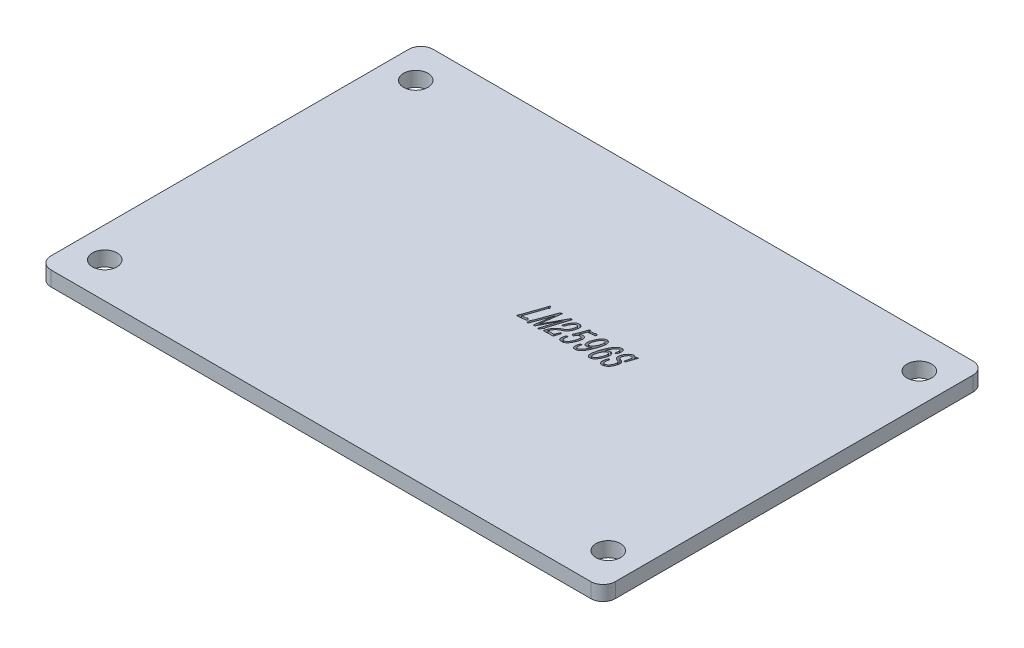
from build123d import *

# Parameters (mm, degrees)
SKETCH_1_R          = 1.65
EXTRUDE_1_DEPTH     = 2
CUT_EXTRUDE_START   = -1
CUT_EXTRUDE_1_DEPTH = 1


# Read off the part's stored shape, not the designer's step: 切除-拉伸1
with BuildPart() as part:
    # 草图1 → 凸台-拉伸1 (new body)
    with BuildSketch(Plane(origin=(0, 0, 0), x_dir=(1, 0, 0), z_dir=(0, 1, 0))):
        with BuildLine():
            Line((36.45, -25.8), (-36.45, -25.8))
            ThreePointArc((-36.45, -25.8), (-37.616726189, -25.316726189), (-38.1, -24.15))
            Line((-38.1, -24.15), (-38.1, 24.15))
            ThreePointArc((-38.1, 24.15), (-37.616726189, 25.316726189), (-36.45, 25.8))
            Line((-36.45, 25.8), (36.45, 25.8))
            ThreePointArc((36.45, 25.8), (37.616726189, 25.316726189), (38.1, 24.15))
            Line((38.1, 24.15), (38.1, -24.15))
            ThreePointArc((38.1, -24.15), (37.616726189, -25.316726189), (36.45, -25.8))
        make_face()
        with Locations(Location((-34, 21, 0), (0, 0, 270))):
            Circle(SKETCH_1_R, mode=Mode.SUBTRACT)
        with Locations(Location((34, 21, 0), (0, 0, 90))):
            Circle(SKETCH_1_R, mode=Mode.SUBTRACT)
        with Locations(Location((34, -21, 0), (0, 0, 270))):
            Circle(SKETCH_1_R, mode=Mode.SUBTRACT)
        with Locations(Location((-34, -21, 0), (0, 0, 90))):
            Circle(SKETCH_1_R, mode=Mode.SUBTRACT)
    extrude(amount=EXTRUDE_1_DEPTH)

    # 切除-拉伸1 outline → 切除-拉伸1 (cut)
    # profile 1 of 7: a face of its own
    with BuildSketch(Plane(origin=(0, 2, 0), x_dir=(1, 0, 0), z_dir=(0, 1, 0)).offset(CUT_EXTRUDE_START)):
        with BuildLine():
            add(Edge.make_bspline(
                [(11.319624973, 2.529725123), (11.326753338, 2.567830624), (11.339981513, 2.638543373), (11.363810052, 2.738810386), (11.386747264, 2.83309971), (11.402493277, 2.928406503), (11.408788686, 3.024022456), (11.40107061, 3.101456515), (11.384715065, 3.156938358), (11.369804851, 3.194089384), (11.348293758, 3.225207318), (11.322963493, 3.250684221), (11.294296694, 3.270288272), (11.263524636, 3.284015152), (11.230211949, 3.291074833), (11.184684427, 3.290006717), (11.129135658, 3.280496298), (11.076013715, 3.25837237), (11.034406929, 3.229718869), (10.996101664, 3.199008787), (10.95262477, 3.156252878), (10.901523079, 3.105345591), (10.847119389, 3.043543935), (10.792558439, 2.971198575), (10.736915044, 2.889534868), (10.664019856, 2.766635878), (10.576158329, 2.602847504), (10.499771775, 2.433051534), (10.445727973, 2.301323215), (10.421585689, 2.239116022), (10.410345271, 2.210525074)],
                knots=[0, 0, 0, 0, 0.048016888, 0.089105405, 0.127654772, 0.168210064, 0.208611881, 0.246125029, 0.263765638, 0.280183723, 0.295474126, 0.310282398, 0.324462469, 0.338252576, 0.351782306, 0.366256964, 0.394408992, 0.421179489, 0.436725185, 0.456877911, 0.481929832, 0.512200465, 0.546242109, 0.583815889, 0.624389886, 0.668597469, 0.76077153, 0.854490538, 0.899099648, 0.93715592, 0.93715592, 0.93715592, 0.93715592], degree=3))
            Line((11.319624973, 2.529725123), (11.486682293, 2.553590454))
            Line((11.486682293, 2.553590454), (11.542616663, 2.577455785))
            Line((11.542616663, 2.577455785), (11.59705945, 2.735563605))
            add(Edge.make_bspline(
                [(11.300980183, 3.558171745), (11.332938296, 3.55537961), (11.391604224, 3.55025405), (11.470752634, 3.530082967), (11.533066183, 3.499358127), (11.576123996, 3.457009642), (11.604543879, 3.412414193), (11.628279189, 3.371220088), (11.645918441, 3.332653625), (11.656575541, 3.294841352), (11.663922251, 3.255421395), (11.665904063, 3.210409655), (11.667264725, 3.158391127), (11.663279952, 3.101732242), (11.660194196, 3.045264039), (11.655589125, 2.993299452), (11.650667761, 2.948240187), (11.642153035, 2.894323663), (11.626748851, 2.823432882), (11.607663016, 2.766946106), (11.59705945, 2.735563605)],
                knots=[0, 0, 0, 0, 0.091586168, 0.168125935, 0.232336966, 0.287622003, 0.338278218, 0.383145194, 0.423552602, 0.459085297, 0.495189033, 0.537922916, 0.587673765, 0.643887342, 0.700141333, 0.749361491, 0.792995872, 0.829682411, 0.905376226, 1, 1, 1, 1], degree=3))
            add(Edge.make_bspline(
                [(10.078627743, 2.088962284), (10.092043775, 2.124514194), (10.117212009, 2.191208933), (10.152737815, 2.284990134), (10.185663794, 2.365405537), (10.225197569, 2.458460171), (10.279164702, 2.571015442), (10.346529938, 2.7098071), (10.422825779, 2.84851108), (10.4891655, 2.962189864), (10.547655064, 3.05014134), (10.597371436, 3.11763489), (10.654008389, 3.186987801), (10.714203242, 3.258491084), (10.779252353, 3.326433394), (10.846166624, 3.388282473), (10.915212273, 3.440367594), (10.984767437, 3.48551032), (11.058000786, 3.520567517), (11.135394035, 3.544224908), (11.216917438, 3.558489113), (11.272581603, 3.55827896), (11.300980183, 3.558171745)],
                knots=[0, 0, 0, 0, 0.056410835, 0.105825706, 0.14886341, 0.185400755, 0.255897094, 0.334127727, 0.414387224, 0.490842857, 0.529430594, 0.571134342, 0.615225599, 0.662339254, 0.709844425, 0.754777107, 0.797439761, 0.838085033, 0.877703722, 0.91750761, 0.957914275, 1, 1, 1, 1], degree=3))
            add(Edge.make_bspline(
                [(10.220328148, 0.281909227), (10.19249915, 0.280098745), (10.138454152, 0.276582721), (10.070837234, 0.287224422), (10.020300058, 0.307853057), (9.981584961, 0.329435729), (9.942445068, 0.358703245), (9.902806204, 0.393420868), (9.86591267, 0.435175841), (9.837901593, 0.485120934), (9.814521026, 0.539843172), (9.797351744, 0.623039326), (9.785413991, 0.73268396), (9.780797995, 0.847487699), (9.785600824, 0.948152915), (9.796865384, 1.037662616), (9.813201733, 1.140700776), (9.835695491, 1.251967632), (9.860700878, 1.361489032), (9.881452444, 1.45999998), (9.901360112, 1.541057249), (9.921795449, 1.627581379), (9.950036536, 1.724331764), (9.987162506, 1.839703457), (10.030604097, 1.961317245), (10.06209135, 2.045009175), (10.078627743, 2.088962284)],
                knots=[0, 0, 0, 0, 0.03956068, 0.07682838, 0.095843058, 0.116866224, 0.139607214, 0.165118082, 0.191658894, 0.218244295, 0.246111869, 0.275832629, 0.33841793, 0.402715898, 0.438774703, 0.481433334, 0.530775575, 0.586935239, 0.642621152, 0.690341085, 0.729908068, 0.761166336, 0.816603174, 0.872993246, 0.933298924, 1, 1, 1, 1], degree=3))
            add(Edge.make_bspline(
                [(11.068293203, 1.084380993), (11.053872372, 1.05541355), (11.023329038, 0.994060479), (10.969919402, 0.900045656), (10.909148123, 0.797266792), (10.842698841, 0.689580228), (10.77067729, 0.585020153), (10.689912589, 0.496193855), (10.604071033, 0.425272911), (10.514549478, 0.373835141), (10.428409541, 0.337241697), (10.350739054, 0.30914977), (10.282885658, 0.289066112), (10.239814747, 0.284138589), (10.220328148, 0.281909227)],
                knots=[0, 0, 0, 0, 0.079263847, 0.167880907, 0.264814542, 0.371790082, 0.477921398, 0.575347443, 0.664953156, 0.749565857, 0.827301008, 0.893958514, 0.952023584, 1, 1, 1, 1], degree=3))
            add(Edge.make_bspline(
                [(10.866929469, 2.42158534), (10.886589109, 2.42118425), (10.924292828, 2.420415029), (10.978317607, 2.413823439), (11.027127036, 2.402341257), (11.0704245, 2.384465457), (11.110126107, 2.363025804), (11.145250427, 2.334657677), (11.177822239, 2.301762803), (11.206196623, 2.262416031), (11.230840866, 2.217275717), (11.251560663, 2.166182107), (11.268932178, 2.109090825), (11.285125994, 2.024054569), (11.296537056, 1.911174741), (11.289262569, 1.794565371), (11.274634537, 1.697461188), (11.256960519, 1.617881049), (11.23389369, 1.53225165), (11.19483815, 1.411518301), (11.141690833, 1.260480826), (11.092451101, 1.142342016), (11.068293203, 1.084380993)],
                knots=[0, 0, 0, 0, 0.036382012, 0.069774277, 0.100580197, 0.128866596, 0.156266865, 0.183794371, 0.212106964, 0.241746136, 0.273258923, 0.307101626, 0.343643368, 0.383535045, 0.467197852, 0.552918689, 0.598998486, 0.648914818, 0.703726948, 0.763108811, 0.883776925, 1, 1, 1, 1], degree=3))
            add(Edge.make_bspline(
                [(10.410345271, 2.210525074), (10.416050186, 2.215819905), (10.449129723, 2.245792172), (10.515387249, 2.296635031), (10.596944633, 2.34739101), (10.669961017, 2.38141985), (10.730958103, 2.401452348), (10.797361446, 2.414729849), (10.843260597, 2.419252922), (10.866929469, 2.42158534)],
                knots=[0.404971471, 0.404971471, 0.404971471, 0.404971471, 0.432023627, 0.560128766, 0.694717093, 0.765101066, 0.83971451, 0.917345382, 1, 1, 1, 1], degree=3))
        make_face()
        with BuildLine():
            add(Edge.make_bspline(
                [(10.78340081, 2.144150863), (10.773100017, 2.142556458), (10.750618648, 2.139076688), (10.716027357, 2.124014401), (10.676728769, 2.104229335), (10.61950773, 2.068122267), (10.549209543, 2.014286204), (10.485947564, 1.949276583), (10.438225331, 1.889966685), (10.402168059, 1.836055129), (10.362124324, 1.775401551), (10.32250004, 1.70543497), (10.282350459, 1.628120598), (10.242879966, 1.544201096), (10.20537119, 1.453333549), (10.182767084, 1.390009052), (10.171105902, 1.35734072)],
                knots=[0, 0, 0, 0, 0.030109941, 0.065714622, 0.108588335, 0.157792871, 0.261597461, 0.364557771, 0.419941904, 0.482122806, 0.552499195, 0.630638236, 0.715103682, 0.805067532, 0.89943673, 1, 1, 1, 1], degree=3))
            add(Edge.make_bspline(
                [(10.994459834, 1.706371191), (10.996023434, 1.727987763), (10.999094338, 1.770442601), (10.998155227, 1.83301138), (10.993304701, 1.893197713), (10.982810117, 1.949506966), (10.969352689, 2.000724278), (10.95159455, 2.044118522), (10.930889814, 2.079967855), (10.905013561, 2.106412307), (10.876785311, 2.125274258), (10.847149319, 2.138714329), (10.815442897, 2.144403173), (10.79410278, 2.144235134), (10.78340081, 2.144150863)],
                knots=[0, 0, 0, 0, 0.117814531, 0.231387145, 0.339957123, 0.445764662, 0.542521874, 0.627383564, 0.700188791, 0.766158301, 0.826528991, 0.884046869, 0.941850039, 1, 1, 1, 1], degree=3))
            add(Edge.make_bspline(
                [(10.261346687, 0.559343703), (10.277116988, 0.561036132), (10.310050452, 0.564570469), (10.359697313, 0.581371719), (10.411370211, 0.606364875), (10.464387545, 0.639656708), (10.516258175, 0.68049559), (10.566448783, 0.725344467), (10.611522599, 0.776372283), (10.667831669, 0.851112799), (10.731329902, 0.95619793), (10.795934626, 1.094643622), (10.855107472, 1.241413379), (10.915663077, 1.390752272), (10.967307612, 1.545247184), (10.985397457, 1.652594138), (10.994459834, 1.706371191)],
                knots=[0, 0, 0, 0, 0.033065291, 0.069050969, 0.108790502, 0.152905102, 0.19956824, 0.246646067, 0.293375687, 0.341592316, 0.442107469, 0.549241177, 0.660589479, 0.772799957, 0.88618076, 1, 1, 1, 1], degree=3))
            add(Edge.make_bspline(
                [(10.171105902, 1.35734072), (10.157214891, 1.313537581), (10.128946777, 1.22439849), (10.099911739, 1.087160277), (10.082936778, 0.949425392), (10.081717538, 0.837543122), (10.089357472, 0.754881106), (10.09924336, 0.701098577), (10.115046922, 0.655622102), (10.133766577, 0.617106754), (10.158955138, 0.587815623), (10.18889873, 0.567377888), (10.224199621, 0.557126412), (10.248618264, 0.55858395), (10.261346687, 0.559343703)],
                knots=[0, 0, 0, 0, 0.152325287, 0.309980926, 0.464393534, 0.611968529, 0.679892627, 0.739554139, 0.792740957, 0.839202455, 0.880695047, 0.919337794, 0.957954149, 1, 1, 1, 1], degree=3))
        make_face(mode=Mode.SUBTRACT)
    # profile 2 of 7: a face of its own
    with BuildSketch(Plane(origin=(0, 2, 0), x_dir=(1, 0, 0), z_dir=(0, 1, 0)).offset(CUT_EXTRUDE_START)):
        with BuildLine():
            add(Edge.make_bspline(
                [(12.912635841, 3.567867036), (12.939142799, 3.565233706), (12.990134196, 3.560167972), (13.061479373, 3.539212889), (13.125736341, 3.511504093), (13.179321881, 3.472634465), (13.224573033, 3.431830655), (13.258620007, 3.394250591), (13.275885689, 3.369629077), (13.28190395, 3.359344784)],
                knots=[0, 0, 0, 0, 0.160913397, 0.309548871, 0.448301289, 0.582320695, 0.708056454, 0.8167907, 0.888918404, 0.888918404, 0.888918404, 0.888918404], degree=3))
            add(Edge.make_bspline(
                [(12.028872789, 2.730343064), (12.037961875, 2.756585471), (12.05554781, 2.807360352), (12.086989767, 2.878979592), (12.11750693, 2.945449357), (12.162163511, 3.025869263), (12.224268655, 3.12064819), (12.306016893, 3.227829835), (12.393614077, 3.323941803), (12.484290088, 3.405999762), (12.578963013, 3.471260438), (12.661240331, 3.516590821), (12.73159073, 3.543940104), (12.788797484, 3.557595487), (12.849411885, 3.567266944), (12.891215329, 3.567663723), (12.912635841, 3.567867036)],
                knots=[0, 0, 0, 0, 0.064498195, 0.12479374, 0.181637338, 0.234373753, 0.338350867, 0.444636662, 0.547250782, 0.640116115, 0.728083073, 0.81387459, 0.857749845, 0.902998931, 0.950295664, 1, 1, 1, 1], degree=3))
            add(Edge.make_bspline(
                [(12.213829107, 1.920413382), (12.18380199, 1.935425676), (12.124665966, 1.964991197), (12.061289845, 2.0182297), (12.019942917, 2.06725959), (11.994543204, 2.10732764), (11.973202676, 2.150129614), (11.957629324, 2.196825794), (11.947181788, 2.247139404), (11.942356007, 2.301149805), (11.941503127, 2.358766382), (11.94621769, 2.42089776), (11.956966845, 2.488708612), (11.974384709, 2.5631426), (11.998467725, 2.64475035), (12.018397516, 2.700854323), (12.028872789, 2.730343064)],
                knots=[0, 0, 0, 0, 0.107404064, 0.211523776, 0.262460483, 0.312661898, 0.363291962, 0.415479857, 0.470049255, 0.527721881, 0.589115285, 0.654664533, 0.727279933, 0.809086455, 0.899654161, 1, 1, 1, 1], degree=3))
            Line((12.213829107, 1.920413382), (12.398039633, 1.841359472))
            add(Edge.make_bspline(
                [(12.585233326, 1.240251438), (12.594400313, 1.274448647), (12.611296104, 1.33747796), (12.62795106, 1.425432934), (12.636008327, 1.498379763), (12.633269717, 1.558239262), (12.622779176, 1.608147262), (12.608581966, 1.652170455), (12.587575031, 1.690922305), (12.562719839, 1.726194961), (12.531116406, 1.757888149), (12.493380693, 1.787946863), (12.448445071, 1.816124798), (12.415345898, 1.832695368), (12.398039633, 1.841359472)],
                knots=[0, 0, 0, 0, 0.149796169, 0.276091238, 0.378589772, 0.459715849, 0.528429664, 0.593977199, 0.65469369, 0.714259707, 0.776015707, 0.843387247, 0.918113307, 1, 1, 1, 1], degree=3))
            add(Edge.make_bspline(
                [(11.931174089, 0.574259535), (11.95160895, 0.574956763), (11.991801323, 0.576328107), (12.050331783, 0.58771282), (12.10533799, 0.6066983), (12.15778136, 0.632425154), (12.207284117, 0.665796263), (12.256453349, 0.704089904), (12.304001843, 0.748899201), (12.363583365, 0.815241572), (12.430281098, 0.898970165), (12.494124356, 1.005113843), (12.545134858, 1.117985543), (12.571358469, 1.197945037), (12.585233326, 1.240251438)],
                knots=[0, 0, 0, 0, 0.06157663, 0.121112194, 0.178948509, 0.236604839, 0.296685232, 0.358612133, 0.424367126, 0.493341319, 0.627383728, 0.746417103, 0.865829817, 1, 1, 1, 1], degree=3))
            add(Edge.make_bspline(
                [(11.776795227, 1.46398892), (11.768461383, 1.425980908), (11.752797092, 1.354541058), (11.732683638, 1.253544708), (11.716322288, 1.165770154), (11.699399386, 1.069455772), (11.687113395, 0.964430817), (11.688733634, 0.867064956), (11.697142974, 0.79769926), (11.708995673, 0.75251395), (11.722406268, 0.711364334), (11.740619482, 0.675611471), (11.760390674, 0.644836582), (11.782109829, 0.620379129), (11.803881566, 0.600607911), (11.835200511, 0.58383917), (11.878312409, 0.573425255), (11.913231895, 0.573976366), (11.931174089, 0.574259535)],
                knots=[0, 0, 0, 0, 0.112864024, 0.212139198, 0.298694179, 0.371837857, 0.495825715, 0.604731979, 0.653479027, 0.698076056, 0.740035884, 0.7787337, 0.814133331, 0.845812142, 0.873421557, 0.898915982, 0.948061405, 1, 1, 1, 1], degree=3))
            Line((11.776795227, 1.46398892), (11.570956744, 1.46398892))
            Line((11.570956744, 1.46398892), (11.482207543, 1.151502237))
            add(Edge.make_bspline(
                [(11.846153846, 0.291604517), (11.821507506, 0.291672515), (11.774402182, 0.291802474), (11.707229629, 0.302668781), (11.647908365, 0.323792617), (11.596166803, 0.353871173), (11.552693807, 0.393226045), (11.514008461, 0.437883281), (11.483088935, 0.490364957), (11.45641734, 0.548064989), (11.437405549, 0.612114312), (11.425614494, 0.681715451), (11.420595756, 0.756164709), (11.423124823, 0.861840183), (11.43937617, 0.995682807), (11.468003001, 1.099826479), (11.482207543, 1.151502237)],
                knots=[0, 0, 0, 0, 0.066209553, 0.126543031, 0.181941951, 0.234679622, 0.286308345, 0.338948483, 0.392946326, 0.449486953, 0.509545765, 0.57196873, 0.638979959, 0.709851081, 0.856029028, 1, 1, 1, 1], degree=3))
            add(Edge.make_bspline(
                [(12.716492649, 0.886746218), (12.690673631, 0.843535161), (12.639155802, 0.757314228), (12.560012956, 0.660765442), (12.494157344, 0.590048647), (12.446439371, 0.542235389), (12.400473609, 0.499550612), (12.354670103, 0.462173232), (12.307160045, 0.427820804), (12.25390394, 0.397983566), (12.195658355, 0.36856258), (12.132248815, 0.342013207), (12.064574224, 0.319473968), (11.993939972, 0.303210907), (11.920780395, 0.293064213), (11.871295667, 0.292096292), (11.846153846, 0.291604517)],
                knots=[0, 0, 0, 0, 0.136340092, 0.272045418, 0.337393071, 0.398407192, 0.455181305, 0.507402547, 0.558653188, 0.613922574, 0.672710074, 0.735558621, 0.800150866, 0.865886795, 0.931860792, 1, 1, 1, 1], degree=3))
            add(Edge.make_bspline(
                [(12.603878116, 2.121777115), (12.625624731, 2.110055924), (12.666928449, 2.087793665), (12.723661478, 2.052989545), (12.771789988, 2.018606704), (12.823834543, 1.974915948), (12.876279106, 1.915606015), (12.913094756, 1.847682595), (12.93267358, 1.790038621), (12.943825739, 1.74470064), (12.947642368, 1.696750531), (12.947439011, 1.629122814), (12.93803875, 1.540489915), (12.922539072, 1.449199842), (12.903377024, 1.372394865), (12.887292499, 1.308688575), (12.865934129, 1.241147333), (12.835749131, 1.144635294), (12.79080682, 1.023351055), (12.741226002, 0.932211244), (12.716492649, 0.886746218)],
                knots=[0, 0, 0, 0, 0.051978856, 0.098724335, 0.139954766, 0.176325786, 0.241579757, 0.305248117, 0.337342347, 0.369572714, 0.403199264, 0.438248371, 0.511800373, 0.590407898, 0.632912887, 0.678337143, 0.72864387, 0.781914954, 0.891208439, 1, 1, 1, 1], degree=3))
            Line((12.603878116, 2.121777115), (12.451736629, 2.191881526))
            add(Edge.make_bspline(
                [(12.251864479, 2.420839548), (12.25546024, 2.402259087), (12.262116354, 2.367864795), (12.280672021, 2.321957054), (12.302840436, 2.284124567), (12.341964771, 2.250166174), (12.392119568, 2.220779682), (12.432728901, 2.201095135), (12.451736629, 2.191881526)],
                knots=[0, 0, 0, 0, 0.175867707, 0.325548712, 0.459851584, 0.579514817, 0.803186428, 1, 1, 1, 1], degree=3))
            add(Edge.make_bspline(
                [(12.827615598, 3.290432559), (12.817908102, 3.289873934), (12.796811475, 3.288659913), (12.768800737, 3.283484538), (12.742880056, 3.273587179), (12.717635925, 3.261203579), (12.687516093, 3.243071278), (12.638434899, 3.211799257), (12.573729795, 3.160269146), (12.503974029, 3.081081866), (12.440608573, 2.992377615), (12.393744172, 2.913555877), (12.361985839, 2.845783376), (12.33736252, 2.789834611), (12.312076152, 2.727980931), (12.287128503, 2.662429917), (12.266514629, 2.596339869), (12.252249856, 2.533358423), (12.24732849, 2.475025625), (12.250408657, 2.438230529), (12.251864479, 2.420839548)],
                knots=[0, 0, 0, 0, 0.02615902, 0.056849589, 0.07610501, 0.100631584, 0.132403363, 0.17061691, 0.257201114, 0.353786648, 0.453453338, 0.550260886, 0.599916659, 0.654714876, 0.714699339, 0.779666327, 0.843339964, 0.900791803, 0.953109843, 1, 1, 1, 1], degree=3))
            add(Edge.make_bspline(
                [(13.052844662, 2.761666312), (13.058173498, 2.789455577), (13.067940833, 2.840391112), (13.076337384, 2.910439693), (13.082173791, 2.966656911), (13.080289229, 3.022987276), (13.06815402, 3.08223188), (13.044263646, 3.146477292), (13.006166289, 3.203274921), (12.955389906, 3.248171568), (12.895185746, 3.281983749), (12.850160063, 3.287613653), (12.827615598, 3.290432559)],
                knots=[0, 0, 0, 0, 0.128213972, 0.235006107, 0.319796701, 0.384071856, 0.489716169, 0.592471914, 0.693117255, 0.796064391, 0.897888965, 1, 1, 1, 1], degree=3))
            Line((13.052844662, 2.761666312), (12.895482634, 2.19859365))
            Line((12.895482634, 2.19859365), (13.099083742, 2.211272107))
            Line((13.099083742, 2.211272107), (13.553270829, 3.524611123))
            Line((13.553270829, 3.524611123), (13.373535052, 3.539526955))
            Line((13.373535052, 3.539526955), (13.28190395, 3.359344784))
        make_face()
    # profile 3 of 7: a face of its own
    with BuildSketch(Plane(origin=(0, 2, 0), x_dir=(1, 0, 0), z_dir=(0, 1, 0)).offset(CUT_EXTRUDE_START)):
        with BuildLine():
            add(Edge.make_bspline(
                [(4.518751332, 2.1941189), (4.52742417, 2.224704013), (4.543586905, 2.281702542), (4.56654992, 2.361132264), (4.587435472, 2.42793498), (4.611929362, 2.503501881), (4.646526277, 2.594316086), (4.67664378, 2.666295228), (4.692520776, 2.704240358)],
                knots=[0, 0, 0, 0, 0.176806308, 0.329496897, 0.459810584, 0.566052454, 0.77123656, 1, 1, 1, 1], degree=3))
            Line((4.518751332, 2.1941189), (4.694012359, 2.217984232))
            Line((4.694012359, 2.217984232), (4.748455146, 2.241103772))
            Line((4.748455146, 2.241103772), (4.808118474, 2.402194758))
            add(Edge.make_bspline(
                [(5.501704667, 3.241210313), (5.482379308, 3.240757185), (5.439944116, 3.239762191), (5.374292699, 3.21333138), (5.303012143, 3.170582731), (5.227738787, 3.109611004), (5.150875726, 3.032289377), (5.078006004, 2.936860027), (5.006798145, 2.824648378), (4.936411066, 2.696335254), (4.86826172, 2.554061095), (4.828402329, 2.453413057), (4.808118474, 2.402194758)],
                knots=[0, 0, 0, 0, 0.050563255, 0.111028292, 0.18322451, 0.269416453, 0.365243966, 0.469747148, 0.584883573, 0.714985691, 0.85496043, 1, 1, 1, 1], degree=3))
            add(Edge.make_bspline(
                [(5.700085233, 2.843703388), (5.702760308, 2.870021391), (5.707874552, 2.920336507), (5.70832801, 2.99333408), (5.700560048, 3.059541133), (5.688387067, 3.11918998), (5.665665647, 3.172021345), (5.623381091, 3.210604938), (5.567076911, 3.234856875), (5.524595988, 3.238985537), (5.501704667, 3.241210313)],
                knots=[0, 0, 0, 0, 0.154058382, 0.294530913, 0.424229108, 0.541566664, 0.649092709, 0.752563447, 0.866666044, 1, 1, 1, 1], degree=3))
            add(Edge.make_bspline(
                [(5.119113573, 1.891327509), (5.137899638, 1.901021344), (5.174046093, 1.919673349), (5.223813272, 1.950516435), (5.268579282, 1.980772805), (5.308239823, 2.014571505), (5.347364494, 2.053553536), (5.387403985, 2.102337589), (5.429373945, 2.162612276), (5.490308836, 2.254276533), (5.559846289, 2.376167772), (5.624751363, 2.528763989), (5.6732433, 2.683894653), (5.691103931, 2.790231434), (5.700085233, 2.843703388)],
                knots=[0, 0, 0, 0, 0.05476668, 0.105377116, 0.151669174, 0.194650271, 0.240210143, 0.294657526, 0.357948043, 0.430501334, 0.579948825, 0.72081211, 0.859609046, 1, 1, 1, 1], degree=3))
            Line((5.119113573, 1.891327509), (4.873002344, 1.763051353))
            add(Edge.make_bspline(
                [(4.026528873, 0.838269763), (4.053436719, 0.893321497), (4.104223711, 0.99722844), (4.186161234, 1.13827915), (4.266099643, 1.256681798), (4.346582779, 1.351995827), (4.424112839, 1.429631638), (4.494949772, 1.497370541), (4.560862148, 1.554686162), (4.642469506, 1.617984485), (4.745186989, 1.687597609), (4.829968468, 1.737646995), (4.873002344, 1.763051353)],
                knots=[0, 0, 0, 0, 0.143839333, 0.271488367, 0.382722806, 0.478837322, 0.563869028, 0.640256739, 0.708952998, 0.768852387, 0.882672751, 1, 1, 1, 1], degree=3))
            add(Edge.make_bspline(
                [(3.969848711, 0.331131472), (3.958861911, 0.330771559), (3.939028006, 0.330121826), (3.912017273, 0.337515829), (3.891466092, 0.352157542), (3.880298429, 0.376235534), (3.878830794, 0.407793192), (3.882801393, 0.448523238), (3.89595605, 0.499146405), (3.921493786, 0.582842534), (3.965870906, 0.697211517), (4.00584785, 0.790176677), (4.026528873, 0.838269763)],
                knots=[0, 0, 0, 0, 0.055062309, 0.09940116, 0.138686278, 0.177851686, 0.228145004, 0.295993015, 0.383390618, 0.490642207, 0.736497112, 1, 1, 1, 1], degree=3))
            Line((3.969848711, 0.331131472), (4.955785212, 0.355742595))
            add(Edge.make_bspline(
                [(5.265288728, 0.553377371), (5.261278348, 0.539966515), (5.254294301, 0.516611612), (5.245518009, 0.485792342), (5.238170034, 0.465080135), (5.231479678, 0.446252079), (5.213569852, 0.425065122), (5.193249486, 0.396911338), (5.156182621, 0.373587741), (5.105742147, 0.364690038), (5.037665859, 0.35589756), (4.98518622, 0.355798239), (4.955785212, 0.355742595)],
                knots=[0, 0, 0, 0, 0.100483591, 0.174991401, 0.22972114, 0.258544779, 0.317448375, 0.426207677, 0.506394728, 0.62409379, 0.789403632, 1, 1, 1, 1], degree=3))
            Line((5.265288728, 0.553377371), (5.480822502, 1.251438312))
            Line((5.480822502, 1.251438312), (5.273492436, 1.251438312))
            Line((5.273492436, 1.251438312), (5.091519284, 0.786064351))
            add(Edge.make_bspline(
                [(5.012465374, 0.642872363), (5.015280268, 0.643394819), (5.020563987, 0.6443755), (5.028521261, 0.650370967), (5.034430882, 0.666113687), (5.04811039, 0.691825755), (5.067938047, 0.733654665), (5.082897328, 0.766901914), (5.091519284, 0.786064351)],
                knots=[0, 0, 0, 0, 0.050886524, 0.095516957, 0.171388695, 0.345046395, 0.622509892, 1, 1, 1, 1], degree=3))
            Line((5.012465374, 0.642872363), (4.21595994, 0.614532282))
            Line((4.21595994, 0.614532282), (4.280098018, 0.772640102))
            add(Edge.make_bspline(
                [(4.915512465, 1.508736416), (4.886179417, 1.492742657), (4.827048838, 1.460501882), (4.742868179, 1.40457342), (4.662415969, 1.34381028), (4.591968595, 1.273672462), (4.528541807, 1.198981821), (4.468398884, 1.120471794), (4.412177336, 1.03414168), (4.359633601, 0.943454614), (4.313400772, 0.85614754), (4.29038255, 0.798428807), (4.280098018, 0.772640102)],
                knots=[0, 0, 0, 0, 0.100736605, 0.203068347, 0.304619499, 0.404315168, 0.502166149, 0.60010617, 0.702437912, 0.812664409, 0.91629854, 1, 1, 1, 1], degree=3))
            Line((4.915512465, 1.508736416), (5.22427019, 1.668335819))
            add(Edge.make_bspline(
                [(5.814191349, 2.308970808), (5.791326086, 2.265279153), (5.74440479, 2.175620482), (5.660051753, 2.049790865), (5.569560284, 1.933450682), (5.486922509, 1.848915338), (5.415063521, 1.792483145), (5.357403798, 1.750233432), (5.293240909, 1.7087072), (5.247746119, 1.68207724), (5.22427019, 1.668335819)],
                knots=[0, 0, 0, 0, 0.166927441, 0.34254808, 0.512188802, 0.665802747, 0.741285181, 0.821454804, 0.907868257, 1, 1, 1, 1], degree=3))
            add(Edge.make_bspline(
                [(5.599403367, 3.538781163), (5.621606813, 3.537117835), (5.664163567, 3.533929778), (5.724784762, 3.520095975), (5.77974091, 3.500313212), (5.828236662, 3.473041702), (5.871005934, 3.441647552), (5.907828012, 3.406681898), (5.938077474, 3.367773107), (5.963172818, 3.325862973), (5.98165253, 3.278828985), (5.996994737, 3.227832865), (6.005073695, 3.171067425), (6.012231251, 3.090010012), (6.009783094, 2.984777885), (5.991678271, 2.856561809), (5.960244821, 2.722605303), (5.919428998, 2.582902167), (5.872535809, 2.44222348), (5.833237055, 2.352469217), (5.814191349, 2.308970808)],
                knots=[0, 0, 0, 0, 0.044636197, 0.085553007, 0.124390622, 0.161466956, 0.196796398, 0.230676006, 0.263017811, 0.295451868, 0.328347086, 0.364194254, 0.402094164, 0.443159791, 0.527501624, 0.612607545, 0.702668551, 0.803424088, 0.90473166, 1, 1, 1, 1], degree=3))
            add(Edge.make_bspline(
                [(4.692520776, 2.704240358), (4.704829383, 2.733376157), (4.728738936, 2.789972648), (4.765412737, 2.871250639), (4.804124408, 2.945167471), (4.842430538, 3.015645801), (4.887979964, 3.083425056), (4.941301867, 3.153346275), (5.005153812, 3.226019045), (5.075500384, 3.300468462), (5.149721381, 3.37039397), (5.225927168, 3.427121407), (5.299901943, 3.471287233), (5.372992327, 3.498431741), (5.440596807, 3.514994961), (5.500260261, 3.529354022), (5.552450691, 3.537226083), (5.58471661, 3.538294735), (5.599403367, 3.538781163)],
                knots=[0, 0, 0, 0, 0.072714776, 0.141248954, 0.204893109, 0.264509684, 0.325534037, 0.392401429, 0.466539591, 0.547790467, 0.627869174, 0.700563736, 0.765849414, 0.825180425, 0.878964782, 0.925827397, 0.966238217, 1, 1, 1, 1], degree=3))
        make_face()
    # profile 4 of 7: a face of its own
    with BuildSketch(Plane(origin=(0, 2, 0), x_dir=(1, 0, 0), z_dir=(0, 1, 0)).offset(CUT_EXTRUDE_START)):
        with BuildLine():
            add(Edge.make_bspline(
                [(3.759535478, 1.011293416), (3.754922021, 0.998411394), (3.74635742, 0.974496709), (3.736445384, 0.940605878), (3.726816458, 0.912364054), (3.719112619, 0.881013608), (3.713109845, 0.845126386), (3.707546363, 0.804614334), (3.706058766, 0.766926656), (3.707628046, 0.734019354), (3.710731277, 0.705928575), (3.710755684, 0.681837677), (3.700151773, 0.65791386), (3.682268159, 0.628493151), (3.65475747, 0.586082516), (3.632149433, 0.554268415), (3.619326657, 0.536224164)],
                knots=[0, 0, 0, 0, 0.080753431, 0.149913804, 0.20839393, 0.25679974, 0.340280675, 0.42310116, 0.498002039, 0.562639444, 0.617115751, 0.66563266, 0.701877649, 0.769590465, 0.869316836, 1, 1, 1, 1], degree=3))
            Line((3.759535478, 1.011293416), (3.828894098, 1.229064564))
            Line((3.828894098, 1.229064564), (4.577668869, 3.593969742))
            Line((4.577668869, 3.593969742), (4.332303431, 3.593969742))
            Line((4.332303431, 3.593969742), (2.815363307, 0.797251225))
            Line((2.815363307, 0.797251225), (3.200191775, 3.593969742))
            Line((3.200191775, 3.593969742), (2.951097379, 3.593969742))
            Line((2.951097379, 3.593969742), (2.087470701, 1.20370765))
            add(Edge.make_bspline(
                [(1.799595142, 0.566055828), (1.801478516, 0.581109529), (1.805173922, 0.610646704), (1.821543585, 0.653578281), (1.845429282, 0.696107861), (1.875545933, 0.736707605), (1.901000571, 0.773152741), (1.921166344, 0.796774711), (1.931063669, 0.815674908), (1.941339048, 0.833170877), (1.950847183, 0.858589935), (1.964007402, 0.887240928), (1.975192454, 0.917106232), (1.986828891, 0.942058714), (1.994834316, 0.961643085), (2.000845452, 0.975295176), (2.006468186, 0.986958971), (2.010972758, 1.001370544), (2.020147647, 1.020673065), (2.028983008, 1.046375699), (2.040498312, 1.077755243), (2.054689916, 1.114356101), (2.070250625, 1.157244706), (2.081484634, 1.187556135), (2.087470701, 1.20370765)],
                knots=[0, 0, 0, 0, 0.064362733, 0.126287432, 0.194015174, 0.271510944, 0.341137925, 0.383462597, 0.40288704, 0.431768008, 0.469698212, 0.518048477, 0.565991795, 0.60531333, 0.635185225, 0.656027709, 0.668812983, 0.690238215, 0.72011011, 0.759616287, 0.805811297, 0.862408184, 0.926683881, 1, 1, 1, 1], degree=3))
            Line((1.799595142, 0.566055828), (1.811527807, 0.348284679))
            add(Edge.make_bspline(
                [(1.857766887, 0.198380567), (1.851709489, 0.199225064), (1.838525031, 0.201063186), (1.822736888, 0.211024146), (1.814233273, 0.226009088), (1.80992754, 0.242607416), (1.808149201, 0.263963083), (1.808153466, 0.288405989), (1.810231987, 0.311719688), (1.8103767, 0.330155913), (1.811603477, 0.341561625), (1.811544602, 0.346792507), (1.811527807, 0.348284679)],
                knots=[0, 0, 0, 0, 0.103457675, 0.225184737, 0.299006802, 0.391175757, 0.514212532, 0.661916962, 0.805649294, 0.911236827, 0.974679241, 1, 1, 1, 1], degree=3))
            add(Edge.make_bspline(
                [(2.066588536, 0.401981675), (2.057289988, 0.378448997), (2.038176198, 0.330075993), (2.007974543, 0.272172839), (1.975065965, 0.230566669), (1.9416431, 0.209155613), (1.901537391, 0.197425234), (1.873012571, 0.198047815), (1.857766887, 0.198380567)],
                knots=[0, 0, 0, 0, 0.238225779, 0.489689114, 0.612577651, 0.732692637, 0.85713202, 1, 1, 1, 1], degree=3))
            Line((2.066588536, 0.401981675), (2.181440443, 0.707756233))
            Line((2.181440443, 0.707756233), (2.933198381, 2.796718517))
            Line((2.933198381, 2.796718517), (2.552098871, 0.322927765))
            Line((2.552098871, 0.322927765), (2.76539527, 0.31621564))
            Line((2.76539527, 0.31621564), (4.072767952, 2.826550181))
            Line((4.072767952, 2.826550181), (3.391860217, 0.733113147))
            Line((3.391860217, 0.733113147), (3.2956531, 0.427338589))
            add(Edge.make_bspline(
                [(3.244939271, 0.252077562), (3.244076606, 0.259799804), (3.241797935, 0.280197582), (3.251889389, 0.317902753), (3.270134432, 0.368247272), (3.286452101, 0.406032651), (3.2956531, 0.427338589)],
                knots=[0, 0, 0, 0, 0.125565402, 0.331672527, 0.62315202, 1, 1, 1, 1], degree=3))
            add(Edge.make_bspline(
                [(3.505966333, 0.367675261), (3.494455365, 0.352371298), (3.473086616, 0.323961301), (3.441222414, 0.286856075), (3.413111385, 0.257719643), (3.380532249, 0.232438728), (3.340231313, 0.213403669), (3.298816062, 0.211295154), (3.271163782, 0.218107417), (3.255222616, 0.225191195), (3.245742075, 0.237650105), (3.245209847, 0.24721496), (3.244939271, 0.252077562)],
                knots=[0, 0, 0, 0, 0.167159473, 0.310311779, 0.426966479, 0.519877317, 0.66953105, 0.808609623, 0.871260354, 0.917867672, 0.958245383, 1, 1, 1, 1], degree=3))
            Line((3.505966333, 0.367675261), (3.619326657, 0.536224164))
        make_face()
    # profile 5 of 7: a face of its own
    with BuildSketch(Plane(origin=(0, 2, 0), x_dir=(1, 0, 0), z_dir=(0, 1, 0)).offset(CUT_EXTRUDE_START)):
        with BuildLine():
            add(Edge.make_bspline(
                [(8.173130194, 1.330492222), (8.166894798, 1.308621546), (8.155069895, 1.267145657), (8.138549738, 1.208008235), (8.124438148, 1.155602287), (8.108655453, 1.092787365), (8.094295896, 1.01296145), (8.080777408, 0.913586682), (8.079345091, 0.811612797), (8.09436686, 0.730672762), (8.11429414, 0.673670829), (8.132475538, 0.637579853), (8.152126106, 0.606758143), (8.175038714, 0.581792848), (8.201963299, 0.56321907), (8.232933859, 0.551493521), (8.267583981, 0.545446051), (8.318167708, 0.546039829), (8.382422177, 0.559227076), (8.445312536, 0.58461919), (8.495638299, 0.616263735), (8.537811208, 0.651702113), (8.586463067, 0.695589767), (8.639578203, 0.749800444), (8.695930399, 0.813291133), (8.752541297, 0.886492586), (8.808448958, 0.969303025), (8.88490698, 1.093203941), (8.976387241, 1.264043175), (9.040871557, 1.407885921), (9.074046452, 1.481887918)],
                knots=[0, 0, 0, 0, 0.031366226, 0.059483398, 0.084683528, 0.106221462, 0.148788073, 0.196461362, 0.24446272, 0.288777514, 0.309165842, 0.327566008, 0.344397941, 0.359437255, 0.373987904, 0.38907794, 0.404748868, 0.422235077, 0.458546602, 0.494521488, 0.515164806, 0.540278486, 0.570376649, 0.605531788, 0.644882388, 0.687403406, 0.733051076, 0.782624689, 0.888168104, 1, 1, 1, 1], degree=3))
            Line((8.173130194, 1.330492222), (8.052311954, 1.306626891))
            Line((8.052311954, 1.306626891), (7.948646921, 1.28276156))
            Line((7.948646921, 1.28276156), (7.912103132, 1.178350735))
            add(Edge.make_bspline(
                [(8.181333902, 0.286383976), (8.160873666, 0.287822735), (8.121073492, 0.290621473), (8.063836046, 0.303910993), (8.010486217, 0.322243319), (7.961800028, 0.347319489), (7.91916732, 0.379912558), (7.883330414, 0.419807162), (7.856737613, 0.46805384), (7.836253817, 0.522255179), (7.824358058, 0.583244383), (7.817712204, 0.649658727), (7.817279749, 0.721767588), (7.822556648, 0.799812335), (7.834986598, 0.884454896), (7.853510647, 0.976180713), (7.880369844, 1.07491894), (7.901215147, 1.142862327), (7.912103132, 1.178350735)],
                knots=[0, 0, 0, 0, 0.055007551, 0.107003176, 0.15725938, 0.206235332, 0.253374724, 0.300669887, 0.349115068, 0.400455005, 0.455713199, 0.515437444, 0.579535696, 0.649128809, 0.725326228, 0.809126768, 0.900302481, 1, 1, 1, 1], degree=3))
            add(Edge.make_bspline(
                [(9.461858087, 1.745898146), (9.437367071, 1.686682548), (9.390532213, 1.573442898), (9.321311486, 1.411437627), (9.25371891, 1.264199023), (9.18657859, 1.127125985), (9.11420762, 0.995163941), (9.032593366, 0.862601406), (8.935141185, 0.726523616), (8.840844669, 0.614405932), (8.758924109, 0.527647508), (8.696631832, 0.470249327), (8.634993239, 0.422182706), (8.573617605, 0.384154216), (8.514321783, 0.354365245), (8.458174476, 0.330513933), (8.405641947, 0.311218653), (8.341350994, 0.296181818), (8.266947717, 0.286024043), (8.208956603, 0.286267846), (8.181333902, 0.286383976)],
                knots=[0, 0, 0, 0, 0.0933016, 0.17842327, 0.256488765, 0.329170216, 0.400608986, 0.475541244, 0.555697532, 0.644076035, 0.68862185, 0.729356176, 0.767292738, 0.802245569, 0.834296723, 0.863811269, 0.891056859, 0.915638031, 0.959816163, 1, 1, 1, 1], degree=3))
            add(Edge.make_bspline(
                [(9.261240145, 3.553696996), (9.291138462, 3.554025011), (9.350785323, 3.5546794), (9.424880873, 3.539360924), (9.482508723, 3.517729969), (9.526098291, 3.494465131), (9.56876625, 3.463128103), (9.61086121, 3.425764639), (9.649914849, 3.381452303), (9.681751898, 3.329112684), (9.704592363, 3.26961564), (9.724152634, 3.183128611), (9.738488832, 3.072680666), (9.745098542, 2.960108041), (9.742249078, 2.864130153), (9.732826633, 2.77917685), (9.715901538, 2.680496764), (9.693248522, 2.573330173), (9.670112114, 2.467114322), (9.646931591, 2.372205518), (9.629208759, 2.292556291), (9.606245605, 2.205930361), (9.578594449, 2.101941398), (9.53923425, 1.978320367), (9.500013852, 1.858059652), (9.473859278, 1.781176478), (9.461858087, 1.745898146)],
                knots=[0, 0, 0, 0, 0.042022022, 0.083833538, 0.105549425, 0.128571957, 0.153152048, 0.179927571, 0.207722664, 0.236000768, 0.265709669, 0.297040815, 0.360659025, 0.422352577, 0.455626199, 0.495755141, 0.542602333, 0.596566009, 0.649991039, 0.695674037, 0.734140798, 0.764877626, 0.821863417, 0.885642275, 0.947526234, 1, 1, 1, 1], degree=3))
            add(Edge.make_bspline(
                [(8.456531004, 2.749733646), (8.470433832, 2.779943736), (8.499726641, 2.843595419), (8.551332059, 2.940867705), (8.612240745, 3.044580335), (8.679126695, 3.152026305), (8.750978569, 3.255109631), (8.829535094, 3.342667997), (8.911181915, 3.411962012), (8.995270404, 3.461574867), (9.075103662, 3.496427649), (9.14546809, 3.524845689), (9.206232133, 3.544396743), (9.244253219, 3.550825001), (9.261240145, 3.553696996)],
                knots=[0, 0, 0, 0, 0.083885869, 0.176744809, 0.277642808, 0.38726805, 0.496045028, 0.594174218, 0.683227605, 0.765079589, 0.839459132, 0.902815481, 0.956580247, 1, 1, 1, 1], degree=3))
            add(Edge.make_bspline(
                [(8.610909866, 1.413275091), (8.594485581, 1.41285115), (8.562781652, 1.412032813), (8.516562708, 1.417782566), (8.473321608, 1.42695778), (8.432972392, 1.44204883), (8.396291169, 1.463059673), (8.363075709, 1.489688073), (8.332863569, 1.521450112), (8.305870018, 1.559003683), (8.282817865, 1.603072118), (8.26250992, 1.653200989), (8.24693093, 1.710212856), (8.227025204, 1.794493707), (8.217152881, 1.908292193), (8.22187555, 2.025885128), (8.236809369, 2.124525427), (8.255157321, 2.205553089), (8.278870393, 2.29304319), (8.320333611, 2.41623638), (8.376573598, 2.570684709), (8.430235664, 2.690850386), (8.456531004, 2.749733646)],
                knots=[0, 0, 0, 0, 0.030771132, 0.059397762, 0.087109985, 0.113520958, 0.139832982, 0.166045684, 0.193086983, 0.221812155, 0.252473599, 0.286152009, 0.323040145, 0.363192746, 0.44846046, 0.536190887, 0.583335406, 0.63537169, 0.691923975, 0.753257496, 0.879091906, 1, 1, 1, 1], degree=3))
            add(Edge.make_bspline(
                [(9.136890995, 1.646380366), (9.128273617, 1.638364452), (9.090597837, 1.604511853), (9.013007861, 1.547674573), (8.920495885, 1.491185326), (8.835608513, 1.449990518), (8.764355334, 1.42888271), (8.688951784, 1.41585164), (8.637316399, 1.414146901), (8.610909866, 1.413275091)],
                knots=[0.363117038, 0.363117038, 0.363117038, 0.363117038, 0.401280353, 0.527386702, 0.674240667, 0.752518812, 0.832607357, 0.914394762, 1, 1, 1, 1], degree=3))
            Line((9.136890995, 1.646380366), (9.074046452, 1.481887918))
        make_face()
        with BuildLine():
            add(Edge.make_bspline(
                [(8.697421692, 1.695930109), (8.714176462, 1.697072693), (8.747946121, 1.699375599), (8.797394202, 1.713930638), (8.8464683, 1.733892593), (8.909797282, 1.771532487), (8.983452766, 1.828610971), (9.049809013, 1.895868999), (9.098060351, 1.957422705), (9.134985952, 2.010622343), (9.174049025, 2.069491243), (9.213683412, 2.135629352), (9.254151226, 2.20907723), (9.292667627, 2.291395835), (9.330063091, 2.382050706), (9.352988032, 2.445847567), (9.364905178, 2.479011293)],
                knots=[0, 0, 0, 0, 0.046456241, 0.093633721, 0.142172609, 0.193153439, 0.297430293, 0.399838747, 0.45433643, 0.514222566, 0.579445749, 0.650289212, 0.728057789, 0.8119654, 0.902253372, 1, 1, 1, 1], degree=3))
            add(Edge.make_bspline(
                [(8.525889623, 2.133709781), (8.522621874, 2.109136346), (8.51633529, 2.0618613), (8.515802205, 1.992492178), (8.517514349, 1.927733207), (8.527748379, 1.868691581), (8.540557059, 1.817241024), (8.555996153, 1.774751983), (8.573394231, 1.742192943), (8.593348917, 1.71861724), (8.616802933, 1.704857186), (8.641459545, 1.695476881), (8.669113048, 1.692685913), (8.687746903, 1.694821369), (8.697421692, 1.695930109)],
                knots=[0, 0, 0, 0, 0.137461551, 0.26445229, 0.384639823, 0.496488605, 0.596231786, 0.678767345, 0.746724861, 0.80047436, 0.847576929, 0.89603467, 0.946020688, 1, 1, 1, 1], degree=3))
            add(Edge.make_bspline(
                [(9.21723844, 3.275516727), (9.205462137, 3.273927091), (9.179545898, 3.270428762), (9.139465994, 3.255265779), (9.094906746, 3.232245043), (9.047153223, 3.201633835), (8.998278512, 3.164196813), (8.952230684, 3.119819253), (8.908277534, 3.070319291), (8.853901525, 2.993099084), (8.788747427, 2.882144525), (8.717465973, 2.736317038), (8.652678822, 2.584540792), (8.600974319, 2.460695719), (8.566336391, 2.363652579), (8.548263076, 2.289070078), (8.533569045, 2.212455177), (8.528465037, 2.160118275), (8.525889623, 2.133709781)],
                knots=[0, 0, 0, 0, 0.02540677, 0.05591296, 0.091185471, 0.132874853, 0.177323725, 0.222933041, 0.26975595, 0.319005709, 0.42511269, 0.545228092, 0.666704705, 0.778825168, 0.832922238, 0.887335982, 0.943151256, 1, 1, 1, 1], degree=3))
            add(Edge.make_bspline(
                [(9.364905178, 2.479011293), (9.378383272, 2.52130362), (9.405119034, 2.605196606), (9.430914601, 2.734147463), (9.444920711, 2.863688443), (9.4443016, 2.971327557), (9.43472618, 3.053993014), (9.422766074, 3.110126888), (9.403618496, 3.15942345), (9.380251293, 3.202291085), (9.350666944, 3.23810513), (9.311894734, 3.261941684), (9.266682891, 3.276037616), (9.234251607, 3.275695958), (9.21723844, 3.275516727)],
                knots=[0, 0, 0, 0, 0.143199211, 0.284056478, 0.423636956, 0.563279705, 0.630368189, 0.692081822, 0.74796889, 0.800426307, 0.849345391, 0.895876061, 0.945377496, 1, 1, 1, 1], degree=3))
        make_face(mode=Mode.SUBTRACT)
    # profile 6 of 7: a face of its own
    with BuildSketch(Plane(origin=(0, 2, 0), x_dir=(1, 0, 0), z_dir=(0, 1, 0)).offset(CUT_EXTRUDE_START)):
        with BuildLine():
            add(Edge.make_bspline(
                [(7.579480077, 3.449286171), (7.593475413, 3.451720445), (7.623842523, 3.457002338), (7.653165966, 3.466525637), (7.668975069, 3.471659919)],
                knots=[0, 0, 0, 0, 0.4608715, 1, 1, 1, 1], degree=3))
            Line((7.579480077, 3.449286171), (7.409439591, 3.429895589))
            Line((7.409439591, 3.429895589), (7.205838483, 3.400063925))
            Line((7.205838483, 3.400063925), (7.100260757, 3.395664853))
            Line((7.100260757, 3.395664853), (7.094715534, 3.408267633))
            add(Edge.make_bspline(
                [(7.061154912, 3.573833369), (7.062967572, 3.559635088), (7.066281664, 3.533676334), (7.073116454, 3.499133051), (7.076125157, 3.471531517), (7.081002215, 3.447226967), (7.084956312, 3.425949753), (7.092016759, 3.413157372), (7.094715534, 3.408267633)],
                knots=[0, 0, 0, 0, 0.252962225, 0.462491481, 0.622225112, 0.742903813, 0.901727964, 1, 1, 1, 1], degree=3))
            Line((7.061154912, 3.573833369), (6.886639676, 3.53728958))
            Line((6.886639676, 3.53728958), (6.841146388, 3.346366929))
            add(Edge.make_bspline(
                [(6.718090773, 2.977945877), (6.722740712, 2.992141191), (6.73272674, 3.022626502), (6.750307542, 3.070783391), (6.768695824, 3.125402492), (6.788357969, 3.182901835), (6.808473797, 3.237355872), (6.822188475, 3.284140685), (6.834688838, 3.318661149), (6.839283733, 3.338375304), (6.841146388, 3.346366929)],
                knots=[0, 0, 0, 0, 0.115331535, 0.247681569, 0.395796515, 0.560305783, 0.716932688, 0.843810444, 0.936684664, 1, 1, 1, 1], degree=3))
            Line((6.718090773, 2.977945877), (6.58161091, 2.597592159))
            Line((6.58161091, 2.597592159), (6.393671426, 2.084487535))
            Line((6.393671426, 2.084487535), (6.32580439, 2.02184104))
            add(Edge.make_bspline(
                [(6.289260601, 1.862987428), (6.283969883, 1.870002743), (6.274104043, 1.883084516), (6.265042835, 1.904011961), (6.261230487, 1.923890238), (6.266318653, 1.950488881), (6.288096812, 1.984716364), (6.312023739, 2.008273417), (6.32580439, 2.02184104)],
                knots=[0, 0, 0, 0, 0.140641681, 0.262260882, 0.363339007, 0.460476974, 0.689263126, 1, 1, 1, 1], degree=3))
            Line((6.289260601, 1.862987428), (6.363839761, 1.78020456))
            add(Edge.make_bspline(
                [(6.580865118, 1.830172597), (6.569375142, 1.810575899), (6.548925784, 1.775698551), (6.513614089, 1.738973832), (6.477036053, 1.729290348), (6.444463866, 1.737143271), (6.405267238, 1.752934555), (6.378709359, 1.770416515), (6.363839761, 1.78020456)],
                knots=[0, 0, 0, 0, 0.250580624, 0.445972451, 0.535999685, 0.652213661, 0.805276507, 1, 1, 1, 1], degree=3))
            Line((6.580865118, 1.830172597), (6.61442574, 1.897293842))
            Line((6.61442574, 1.897293842), (6.658427445, 1.948753463))
            add(Edge.make_bspline(
                [(7.052205412, 2.183677818), (7.02835362, 2.181818278), (6.978815125, 2.177956145), (6.907520595, 2.149738506), (6.838332665, 2.111716445), (6.773231296, 2.064552502), (6.711865608, 2.010888359), (6.676352645, 1.969595879), (6.658427445, 1.948753463)],
                knots=[0, 0, 0, 0, 0.151511683, 0.31467911, 0.482505943, 0.653751459, 0.825230738, 1, 1, 1, 1], degree=3))
            add(Edge.make_bspline(
                [(7.171532069, 1.434157255), (7.180483022, 1.464917358), (7.19752158, 1.523470648), (7.217820397, 1.607484819), (7.235246201, 1.682311713), (7.248500024, 1.768600925), (7.256643021, 1.865546542), (7.252596545, 1.956604567), (7.240506711, 2.021455773), (7.227978475, 2.063449447), (7.208499026, 2.09866527), (7.185460732, 2.128420402), (7.157432333, 2.151479149), (7.126173774, 2.169596493), (7.090296026, 2.179685183), (7.065184971, 2.182317308), (7.052205412, 2.183677818)],
                knots=[0, 0, 0, 0, 0.111039902, 0.211369636, 0.299611658, 0.377255983, 0.513814252, 0.636385446, 0.69165568, 0.742348913, 0.78746864, 0.830403775, 0.872003447, 0.912517723, 0.954781615, 1, 1, 1, 1], degree=3))
            add(Edge.make_bspline(
                [(6.461538462, 0.563818453), (6.481503524, 0.563770507), (6.523245455, 0.563670263), (6.57630968, 0.577101114), (6.622250672, 0.595087466), (6.66056202, 0.618405447), (6.703633133, 0.647691669), (6.76620422, 0.697730858), (6.842808625, 0.772033445), (6.920757639, 0.879646004), (6.990029168, 1.000334391), (7.057458792, 1.132868976), (7.119253738, 1.278575254), (7.153822136, 1.381451922), (7.171532069, 1.434157255)],
                knots=[0, 0, 0, 0, 0.050159873, 0.104871699, 0.136635163, 0.174249523, 0.217522869, 0.267916989, 0.376023216, 0.485296083, 0.601566075, 0.726538878, 0.859901572, 1, 1, 1, 1], degree=3))
            add(Edge.make_bspline(
                [(6.282548476, 1.330492222), (6.276692418, 1.31064263), (6.265461528, 1.272574597), (6.25156943, 1.217477351), (6.239585349, 1.167519878), (6.226294485, 1.107884922), (6.215694693, 1.035914079), (6.206228141, 0.952593219), (6.204022449, 0.875554867), (6.207249256, 0.806949877), (6.222094549, 0.744797336), (6.243988935, 0.685736457), (6.275911786, 0.632528105), (6.312735325, 0.597861471), (6.348434314, 0.579166752), (6.381429452, 0.571409886), (6.419520234, 0.564857829), (6.446832012, 0.564182237), (6.461538462, 0.563818453)],
                knots=[0, 0, 0, 0, 0.067222774, 0.128921472, 0.184550217, 0.234128813, 0.327332537, 0.420707537, 0.506344426, 0.577575739, 0.643008993, 0.713049264, 0.781616819, 0.84278472, 0.874568596, 0.911399538, 0.952291708, 1, 1, 1, 1], degree=3))
            Line((6.282548476, 1.330492222), (6.090134242, 1.330492222))
            Line((6.090134242, 1.330492222), (6.01928404, 1.146281696))
            add(Edge.make_bspline(
                [(6.386213509, 0.291604517), (6.367325029, 0.291236016), (6.331282079, 0.290532841), (6.279409554, 0.291404588), (6.232897545, 0.297017972), (6.177652418, 0.305918061), (6.113842867, 0.331863217), (6.058703705, 0.373220603), (6.018692255, 0.414107231), (5.993973985, 0.451410971), (5.970915446, 0.491593243), (5.948194143, 0.550417798), (5.929526002, 0.625210484), (5.924400869, 0.717636106), (5.934796839, 0.81464029), (5.952186289, 0.921366119), (5.978921562, 1.034584076), (6.005889865, 1.109215154), (6.01928404, 1.146281696)],
                knots=[0, 0, 0, 0, 0.048638267, 0.092811416, 0.133374584, 0.1691473, 0.236643126, 0.308062528, 0.345177992, 0.383343306, 0.422873695, 0.464226708, 0.545244447, 0.620249179, 0.701186007, 0.795868487, 0.898615301, 1, 1, 1, 1], degree=3))
            add(Edge.make_bspline(
                [(7.420626465, 1.356594929), (7.4091178, 1.326196132), (7.386950961, 1.267645014), (7.352016108, 1.183964851), (7.319878991, 1.10648626), (7.277569497, 1.014619248), (7.225105063, 0.909225523), (7.155411606, 0.792334252), (7.077349924, 0.682000283), (6.986991843, 0.58046288), (6.890729605, 0.4874425), (6.79163151, 0.410356208), (6.692590027, 0.352276149), (6.593031303, 0.31407486), (6.490574448, 0.295764606), (6.421576741, 0.293014185), (6.386213509, 0.291604517)],
                knots=[0, 0, 0, 0, 0.061618478, 0.118683344, 0.171905317, 0.220623276, 0.310413944, 0.394960289, 0.47840253, 0.566233556, 0.652238603, 0.731894684, 0.803681685, 0.86915913, 0.932940438, 1, 1, 1, 1], degree=3))
            add(Edge.make_bspline(
                [(7.149904113, 2.456637545), (7.175559668, 2.454877121), (7.223165234, 2.451610539), (7.28841668, 2.440257121), (7.34221444, 2.422871274), (7.397925587, 2.390207033), (7.453392465, 2.334051484), (7.499196908, 2.268558189), (7.528747754, 2.207415203), (7.544977393, 2.155101826), (7.556014217, 2.098328375), (7.561797591, 2.036650859), (7.562559024, 1.96953517), (7.556771053, 1.896570461), (7.546481755, 1.817323909), (7.523296785, 1.701297152), (7.484113026, 1.545916503), (7.442379329, 1.421463564), (7.420626465, 1.356594929)],
                knots=[0, 0, 0, 0, 0.056808557, 0.105412004, 0.146070997, 0.1810332, 0.247099352, 0.318580126, 0.356919479, 0.396711652, 0.439275091, 0.484543562, 0.533447329, 0.58743021, 0.646177253, 0.709969786, 0.848827484, 1, 1, 1, 1], degree=3))
            add(Edge.make_bspline(
                [(6.755952155, 2.339940678), (6.770738272, 2.349457451), (6.817966869, 2.376044822), (6.88488463, 2.407947009), (6.957880723, 2.433248291), (7.018560796, 2.447390987), (7.083042464, 2.455756799), (7.12725632, 2.456339214), (7.149904113, 2.456637545)],
                knots=[0.28946936, 0.28946936, 0.28946936, 0.28946936, 0.379364598, 0.565983797, 0.668136821, 0.773945148, 0.884207264, 1, 1, 1, 1], degree=3))
            Line((6.755952155, 2.339940678), (7.03728958, 3.124121031))
            Line((7.03728958, 3.124121031), (7.916577882, 3.241210313))
            add(Edge.make_bspline(
                [(8.054549329, 3.399318133), (8.058285793, 3.391218839), (8.065131854, 3.376379067), (8.071024041, 3.3544341), (8.070682334, 3.334816995), (8.061868525, 3.313340497), (8.043521989, 3.290995901), (8.023985067, 3.268409221), (8.001208012, 3.253811797), (7.97803664, 3.246064733), (7.949045006, 3.241907051), (7.928027983, 3.24145603), (7.916577882, 3.241210313)],
                knots=[0, 0, 0, 0, 0.102460846, 0.18773185, 0.259246257, 0.323478349, 0.450407048, 0.58987874, 0.664413839, 0.758433787, 0.86839442, 1, 1, 1, 1], degree=3))
            Line((8.054549329, 3.399318133), (7.921798423, 3.558917537))
            Line((7.921798423, 3.558917537), (7.814404432, 3.522373748))
            add(Edge.make_bspline(
                [(7.753249521, 3.500745792), (7.761405331, 3.503868484), (7.775657845, 3.509325479), (7.79444034, 3.514667865), (7.806443287, 3.519408001), (7.812414146, 3.521632311), (7.814404432, 3.522373748)],
                knots=[0, 0, 0, 0, 0.403633908, 0.705361979, 0.901787326, 1, 1, 1, 1], degree=3))
            Line((7.753249521, 3.500745792), (7.668975069, 3.471659919))
        make_face()
    # profile 7 of 7: a face of its own
    with BuildSketch(Plane(origin=(0, 2, 0), x_dir=(1, 0, 0), z_dir=(0, 1, 0)).offset(CUT_EXTRUDE_START)):
        with BuildLine():
            add(Edge.make_bspline(
                [(1.733219689, 3.37918176), (1.725376457, 3.369886912), (1.711062033, 3.352923192), (1.689852561, 3.330937844), (1.675232134, 3.31098773), (1.655318768, 3.290585087), (1.633648952, 3.255511768), (1.606622252, 3.202983633), (1.576522575, 3.138436643), (1.559797674, 3.090965967), (1.551246537, 3.066695078)],
                knots=[0, 0, 0, 0, 0.099898807, 0.182322012, 0.250574036, 0.302639007, 0.415918867, 0.586741294, 0.788708372, 1, 1, 1, 1], degree=3))
            Line((1.733219689, 3.37918176), (1.552738121, 3.697634775))
            Line((1.552738121, 3.697634775), (1.41774984, 3.610377157))
            Line((1.41774984, 3.610377157), (1.487854251, 3.605156616))
            Line((1.487854251, 3.605156616), (1.407308758, 3.547730663))
            add(Edge.make_bspline(
                [(1.284998935, 3.08161091), (1.294570935, 3.108914474), (1.311763714, 3.15795586), (1.332892968, 3.223339029), (1.349018936, 3.271417758), (1.362121012, 3.3139578), (1.375110357, 3.358376442), (1.389969408, 3.412997538), (1.402569644, 3.476639559), (1.405646879, 3.522800937), (1.407308758, 3.547730663)],
                knots=[0, 0, 0, 0, 0.179470369, 0.322356288, 0.426229527, 0.494030388, 0.59846304, 0.713296925, 0.845164304, 1, 1, 1, 1], degree=3))
            Line((1.284998935, 3.08161091), (0.515341999, 0.858406137))
            Line((0.515341999, 0.858406137), (0.40421905, 0.568293203))
            add(Edge.make_bspline(
                [(0.444491796, 0.307266141), (0.433091032, 0.305233822), (0.412376208, 0.301541162), (0.383987522, 0.300463667), (0.361267895, 0.303504207), (0.340017152, 0.314324963), (0.324796568, 0.336341359), (0.319928804, 0.368333417), (0.331141299, 0.405206333), (0.351268532, 0.449741486), (0.377892624, 0.504849715), (0.394998682, 0.546073235), (0.40421905, 0.568293203)],
                knots=[0, 0, 0, 0, 0.091219679, 0.165743226, 0.223435616, 0.26991151, 0.349907222, 0.423392062, 0.51802396, 0.648022305, 0.810279841, 1, 1, 1, 1], degree=3))
            Line((0.444491796, 0.307266141), (0.551139996, 0.31621564))
            Line((0.551139996, 0.31621564), (0.765182186, 0.336352014))
            add(Edge.make_bspline(
                [(1.586298743, 0.46462817), (1.577826991, 0.454201333), (1.561190354, 0.433725343), (1.528415119, 0.411708467), (1.490969887, 0.399414109), (1.438135064, 0.396122202), (1.374284684, 0.400080219), (1.301965518, 0.39036046), (1.233553347, 0.380395926), (1.181461125, 0.372095434), (1.141555253, 0.368196858), (1.111982409, 0.365125258), (1.074476915, 0.361261142), (1.028394921, 0.358070807), (0.974339933, 0.351964065), (0.911792884, 0.348560322), (0.841298376, 0.341752965), (0.791543006, 0.33822249), (0.765182186, 0.336352014)],
                knots=[0, 0, 0, 0, 0.047418293, 0.093118985, 0.137701711, 0.185486993, 0.279769346, 0.36394046, 0.443194407, 0.525064919, 0.550754446, 0.585299316, 0.630453085, 0.684383097, 0.749001622, 0.823206251, 0.906333162, 1, 1, 1, 1], degree=3))
            add(Edge.make_bspline(
                [(1.41774984, 0.735350522), (1.427790564, 0.731183829), (1.448325909, 0.722662085), (1.473738034, 0.698338052), (1.49764135, 0.668151146), (1.522339511, 0.633804496), (1.547652297, 0.597821859), (1.571965024, 0.5655116), (1.592142652, 0.537667221), (1.598283949, 0.510456647), (1.594175088, 0.486734128), (1.589015907, 0.472254235), (1.586298743, 0.46462817)],
                knots=[0, 0, 0, 0, 0.094850832, 0.193989458, 0.304289386, 0.434173838, 0.565831226, 0.690896859, 0.791019098, 0.864775966, 0.928782122, 1, 1, 1, 1], degree=3))
            add(Edge.make_bspline(
                [(0.695077775, 0.594395909), (0.707510273, 0.594530863), (0.733899853, 0.594817322), (0.770261639, 0.59733195), (0.809189919, 0.602563386), (0.854397665, 0.60855615), (0.915108033, 0.615850463), (0.985989577, 0.624824154), (1.057308779, 0.634732283), (1.119003295, 0.643433242), (1.165969908, 0.651017344), (1.209833063, 0.658145512), (1.255390912, 0.674309803), (1.294513872, 0.700659475), (1.32746914, 0.721965418), (1.355789958, 0.732738528), (1.386305636, 0.73718026), (1.407055934, 0.735972801), (1.41774984, 0.735350522)],
                knots=[0, 0, 0, 0, 0.050062463, 0.106264037, 0.146617615, 0.208204511, 0.289905081, 0.392838047, 0.495902357, 0.57985332, 0.643708953, 0.687492693, 0.758736168, 0.835992256, 0.876851739, 0.916453322, 0.956943251, 1, 1, 1, 1], degree=3))
            Line((0.695077775, 0.594395909), (1.551246537, 3.066695078))
        make_face()
    extrude(amount=CUT_EXTRUDE_1_DEPTH, mode=Mode.SUBTRACT)


solid = part.part
